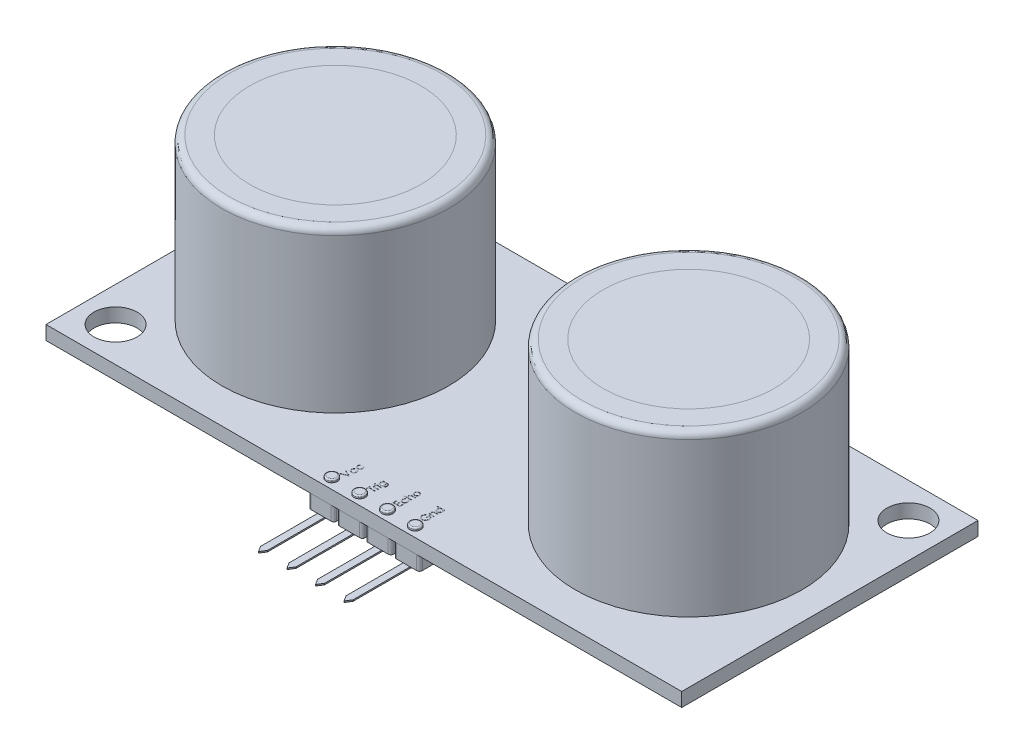
from build123d import *

# Parameters (mm, degrees)
SKETCH1_W              = 45.7
SKETCH1_H              = 21.3
SKETCH1_R              = 1.55
BOSS_EXTRUDE1_DEPTH    = 1
SKETCH2_R              = 8.15
SKETCH2_R_2            = 6.15
BOSS_EXTRUDE2_DEPTH    = 11.54
BOSS_EXTRUDE2_2_DEPTH  = 11.54
FILLET1_R              = 0.5
FILLET2_R              = 0.5
SKETCH3_R              = 6
BOSS_EXTRUDE3_DEPTH    = 7
BOSS_EXTRUDE3_2_DEPTH  = 7
LPATTERN2_COUNT        = 2
LPATTERN2_PITCH        = 25.4
SKETCH6_R              = 6.15
BOSS_EXTRUDE4_DEPTH    = 0.2
BOSS_EXTRUDE4_2_DEPTH  = 0.2
BOSS_EXTRUDE10_DEPTH   = 1
BOSS_EXTRUDE10_2_DEPTH = 1
BOSS_EXTRUDE10_3_DEPTH = 1
BOSS_EXTRUDE10_4_DEPTH = 1
SKETCH13_R             = 0.4
BOSS_EXTRUDE8_DEPTH    = 0.2
BOSS_EXTRUDE8_2_DEPTH  = 0.2
BOSS_EXTRUDE8_3_DEPTH  = 0.2
BOSS_EXTRUDE8_4_DEPTH  = 0.2
FILLET3_R              = 0.1
FILLET4_R              = 0.1
FILLET5_R              = 0.1
FILLET6_R              = 0.1
SKETCH15_W             = 0.365384615
SKETCH15_H             = 0.044871795
CUT_EXTRUDE5_DEPTH     = 0.01
BOSS_EXTRUDE11_DEPTH   = 0.1
BOSS_EXTRUDE11_2_DEPTH = 0.1
BOSS_EXTRUDE11_3_DEPTH = 0.1
BOSS_EXTRUDE11_4_DEPTH = 0.1
BOSS_EXTRUDE13_DEPTH   = 0.5
BOSS_EXTRUDE14_DEPTH   = 1.5
FILLET7_R              = 0.1


with BuildPart() as part:
    # Sketch1 → Boss-Extrude1 (new body)
    with BuildSketch(Plane(origin=(0, 0, 0), x_dir=(1, 0, 0), z_dir=(0, 1, 0))):
        Rectangle(SKETCH1_W, SKETCH1_H)
        with Locations((20.35, 8.15)):
            Circle(SKETCH1_R, mode=Mode.SUBTRACT)
        with Locations((-20.35, -8.15)):
            Circle(SKETCH1_R, mode=Mode.SUBTRACT)
    extrude(amount=BOSS_EXTRUDE1_DEPTH)

    # Sketch15 → Cut-Extrude5 (cut)
    # profile 1 of 15: a face of its own
    with BuildSketch(Plane(origin=(0, 1, 0), x_dir=(1, 0, 0), z_dir=(0, 1, 0))):
        with BuildLine():
            Line((-2.771008341, -8.073076923), (-2.747671001, -8.110637019))
            add(Edge.make_bspline(
                [(-2.747671001, -8.110637019), (-2.752789343, -8.114755571), (-2.76286393, -8.122862242), (-2.775865349, -8.136939276), (-2.787032069, -8.151940907), (-2.796132605, -8.168123485), (-2.803164241, -8.185464313), (-2.808139985, -8.203895006), (-2.811240591, -8.223412936), (-2.811592996, -8.236793678), (-2.811773565, -8.24364984)],
                knots=[0, 0, 0, 0, 1.026593902, 2.0206758, 2.988051866, 3.946915611, 4.916868779, 5.907761954, 6.927957743, 8, 8, 8, 8], degree=3))
            add(Edge.make_bspline(
                [(-2.811773565, -8.24364984), (-2.811622588, -8.249129691), (-2.811325242, -8.259922108), (-2.8094666, -8.275765844), (-2.80608917, -8.290857609), (-2.801639033, -8.305291996), (-2.795674706, -8.318966342), (-2.78841617, -8.331916473), (-2.779980449, -8.344257257), (-2.770207514, -8.355631077), (-2.759579133, -8.366035221), (-2.748185748, -8.375049352), (-2.736368621, -8.382897485), (-2.723832658, -8.389055479), (-2.71086465, -8.394094789), (-2.697219814, -8.397410035), (-2.683072955, -8.399619277), (-2.673427478, -8.399872038), (-2.668544398, -8.4)],
                knots=[0, 0, 0, 0, 1.112346261, 2.190735716, 3.231507886, 4.247384806, 5.251966152, 6.253067467, 7.256802811, 8.280671706, 9.291813951, 10.270744147, 11.225547591, 12.165006084, 13.100104208, 14.043489273, 15.009504848, 16, 16, 16, 16], degree=3))
            add(Edge.make_bspline(
                [(-2.668544398, -8.4), (-2.662149711, -8.399741969), (-2.649413775, -8.399228063), (-2.630645809, -8.395319409), (-2.612533755, -8.388779202), (-2.595175531, -8.379943686), (-2.579092049, -8.368728456), (-2.564665471, -8.355562063), (-2.552177566, -8.340430467), (-2.541824321, -8.323468787), (-2.533501276, -8.305074802), (-2.527571655, -8.28544765), (-2.523992745, -8.26474768), (-2.523541896, -8.250575287), (-2.523312027, -8.243349359)],
                knots=[0, 0, 0, 0, 0.96628757, 1.924499989, 2.884001032, 3.87047137, 4.860396324, 5.839257425, 6.814467993, 7.816059692, 8.834901047, 9.858382822, 10.908076205, 12, 12, 12, 12], degree=3))
            add(Edge.make_bspline(
                [(-2.523312027, -8.243349359), (-2.523497669, -8.23672719), (-2.523862506, -8.22371287), (-2.526938072, -8.204688972), (-2.531972877, -8.186577556), (-2.53899397, -8.169379266), (-2.548069329, -8.153125528), (-2.559263496, -8.13792136), (-2.572254439, -8.123464226), (-2.582299864, -8.114964658), (-2.587414591, -8.110637019)],
                knots=[0, 0, 0, 0, 1.039848629, 2.043578496, 3.018386758, 3.987534228, 4.954977003, 5.934852016, 6.948509513, 8, 8, 8, 8], degree=3))
            Line((-2.587414591, -8.110637019), (-2.562775168, -8.073076923))
            add(Edge.make_bspline(
                [(-2.562775168, -8.073076923), (-2.559505064, -8.075303738), (-2.55297571, -8.079749976), (-2.543769408, -8.087182494), (-2.535152024, -8.095199613), (-2.527135111, -8.103770055), (-2.519526823, -8.112781914), (-2.512690884, -8.122543043), (-2.506243052, -8.132738702), (-2.500441213, -8.143488582), (-2.495226024, -8.154681539), (-2.490741571, -8.166301823), (-2.486888699, -8.178298939), (-2.483826221, -8.190686993), (-2.481381815, -8.203490407), (-2.479759858, -8.216676069), (-2.478549104, -8.230239438), (-2.478476837, -8.239406888), (-2.478440232, -8.244050481)],
                knots=[0, 0, 0, 0, 0.954134338, 1.905101784, 2.851144739, 3.791306361, 4.734911809, 5.6936923, 6.663572882, 7.643865596, 8.638447847, 9.640600242, 10.646758161, 11.676244097, 12.717260333, 13.78922464, 14.880174919, 16, 16, 16, 16], degree=3))
            add(Edge.make_bspline(
                [(-2.478440232, -8.244050481), (-2.478567769, -8.251137657), (-2.478817743, -8.265028574), (-2.481558826, -8.285361669), (-2.485706466, -8.304787443), (-2.491608966, -8.323340034), (-2.499403895, -8.340906018), (-2.508707421, -8.357631633), (-2.519826998, -8.373344282), (-2.532498463, -8.387940957), (-2.546251285, -8.401289611), (-2.561005999, -8.41290504), (-2.576436566, -8.422748753), (-2.592640251, -8.430857682), (-2.60955061, -8.437198108), (-2.627270949, -8.441563266), (-2.645650922, -8.444379814), (-2.658184043, -8.444706284), (-2.664537988, -8.444871795)],
                knots=[0, 0, 0, 0, 1.113096611, 2.181677437, 3.217994567, 4.231807234, 5.234933164, 6.233258928, 7.234764453, 8.254006763, 9.267004511, 10.242118657, 11.199842941, 12.138404996, 13.084707599, 14.031460992, 15.002005182, 16, 16, 16, 16], degree=3))
            add(Edge.make_bspline(
                [(-2.664537988, -8.444871795), (-2.668849193, -8.444808793), (-2.677424891, -8.444683471), (-2.690152758, -8.443246052), (-2.702711122, -8.441389128), (-2.714940796, -8.438242594), (-2.727027266, -8.434608218), (-2.738824852, -8.429968856), (-2.750388376, -8.424526657), (-2.761688052, -8.418347807), (-2.772537986, -8.411392272), (-2.78278851, -8.403694953), (-2.792562762, -8.395545762), (-2.801523299, -8.386563461), (-2.810028469, -8.377129224), (-2.817851059, -8.366976142), (-2.825014057, -8.356162449), (-2.831649917, -8.344850546), (-2.837558407, -8.333047016), (-2.84264887, -8.320823206), (-2.846999238, -8.308252773), (-2.850443369, -8.295315609), (-2.853331572, -8.282097585), (-2.855148408, -8.268494536), (-2.856432161, -8.254558505), (-2.856573703, -8.24512193), (-2.85664536, -8.240344551)],
                knots=[0, 0, 0, 0, 0.990994727, 1.971252077, 2.943264845, 3.907940874, 4.872158414, 5.844625996, 6.82015047, 7.809835459, 8.804511986, 9.781214284, 10.756496977, 11.728388426, 12.696359165, 13.676225489, 14.672885716, 15.677705647, 16.690706858, 17.706033469, 18.721040654, 19.747369689, 20.783475414, 21.830280724, 22.901553713, 24, 24, 24, 24], degree=3))
            add(Edge.make_bspline(
                [(-2.85664536, -8.240344551), (-2.856513675, -8.234361671), (-2.856250963, -8.222425816), (-2.854039524, -8.204720112), (-2.850706512, -8.187274669), (-2.84576471, -8.170398053), (-2.839794347, -8.154285867), (-2.833049525, -8.139243645), (-2.825383038, -8.125498557), (-2.816841822, -8.112929361), (-2.807112014, -8.101539541), (-2.796292651, -8.091037172), (-2.784305854, -8.081353058), (-2.775477426, -8.075858402), (-2.771008341, -8.073076923)],
                knots=[0, 0, 0, 0, 1.095139042, 2.184804066, 3.262657822, 4.34424993, 5.400369085, 6.407210964, 7.359649996, 8.278719237, 9.185177137, 10.097389079, 11.036869154, 12, 12, 12, 12], degree=3))
        make_face()
    # profile 2 of 15: a face of its own
    with BuildSketch(Plane(origin=(0, 1, 0), x_dir=(1, 0, 0), z_dir=(0, 1, 0))):
        with BuildLine():
            Line((-2.771008341, -8.521794872), (-2.747671001, -8.559354968))
            add(Edge.make_bspline(
                [(-2.747671001, -8.559354968), (-2.752789343, -8.56347352), (-2.76286393, -8.571580191), (-2.775865349, -8.585657225), (-2.787032069, -8.600658855), (-2.796132605, -8.616841434), (-2.803164241, -8.634182262), (-2.808139985, -8.652612955), (-2.811240591, -8.672130884), (-2.811592996, -8.685511627), (-2.811773565, -8.692367788)],
                knots=[0, 0, 0, 0, 1.026593902, 2.0206758, 2.988051866, 3.946915611, 4.916868779, 5.907761954, 6.927957743, 8, 8, 8, 8], degree=3))
            add(Edge.make_bspline(
                [(-2.811773565, -8.692367788), (-2.811622588, -8.697847639), (-2.811325242, -8.708640057), (-2.8094666, -8.724483793), (-2.80608917, -8.739575558), (-2.801639033, -8.754009945), (-2.795674706, -8.76768429), (-2.78841617, -8.780634422), (-2.779980449, -8.792975206), (-2.770207514, -8.804349026), (-2.759579133, -8.81475317), (-2.748185748, -8.823767301), (-2.736368621, -8.831615434), (-2.723832658, -8.837773428), (-2.71086465, -8.842812738), (-2.697219814, -8.846127983), (-2.683072955, -8.848337226), (-2.673427478, -8.848589987), (-2.668544398, -8.848717949)],
                knots=[0, 0, 0, 0, 1.112346261, 2.190735716, 3.231507886, 4.247384806, 5.251966152, 6.253067467, 7.256802811, 8.280671706, 9.291813951, 10.270744147, 11.225547591, 12.165006084, 13.100104208, 14.043489273, 15.009504848, 16, 16, 16, 16], degree=3))
            add(Edge.make_bspline(
                [(-2.668544398, -8.848717949), (-2.662149711, -8.848459918), (-2.649413775, -8.847946012), (-2.630645809, -8.844037358), (-2.612533755, -8.837497151), (-2.595175531, -8.828661635), (-2.579092049, -8.817446404), (-2.564665471, -8.804280012), (-2.552177566, -8.789148415), (-2.541824321, -8.772186736), (-2.533501276, -8.75379275), (-2.527571655, -8.734165599), (-2.523992745, -8.713465628), (-2.523541896, -8.699293236), (-2.523312027, -8.692067308)],
                knots=[0, 0, 0, 0, 0.96628757, 1.924499989, 2.884001032, 3.87047137, 4.860396324, 5.839257425, 6.814467993, 7.816059692, 8.834901047, 9.858382822, 10.908076205, 12, 12, 12, 12], degree=3))
            add(Edge.make_bspline(
                [(-2.523312027, -8.692067308), (-2.523497669, -8.685445138), (-2.523862506, -8.672430819), (-2.526938072, -8.653406921), (-2.531972877, -8.635295505), (-2.53899397, -8.618097215), (-2.548069329, -8.601843477), (-2.559263496, -8.586639309), (-2.572254439, -8.572182175), (-2.582299864, -8.563682607), (-2.587414591, -8.559354968)],
                knots=[0, 0, 0, 0, 1.039848629, 2.043578496, 3.018386758, 3.987534228, 4.954977003, 5.934852016, 6.948509513, 8, 8, 8, 8], degree=3))
            Line((-2.587414591, -8.559354968), (-2.562775168, -8.521794872))
            add(Edge.make_bspline(
                [(-2.562775168, -8.521794872), (-2.559505064, -8.524021686), (-2.55297571, -8.528467925), (-2.543769408, -8.535900442), (-2.535152024, -8.543917561), (-2.527135111, -8.552488004), (-2.519526823, -8.561499862), (-2.512690884, -8.571260992), (-2.506243052, -8.581456651), (-2.500441213, -8.592206531), (-2.495226024, -8.603399487), (-2.490741571, -8.615019772), (-2.486888699, -8.627016888), (-2.483826221, -8.639404942), (-2.481381815, -8.652208356), (-2.479759858, -8.665394018), (-2.478549104, -8.678957386), (-2.478476837, -8.688124837), (-2.478440232, -8.692768429)],
                knots=[0, 0, 0, 0, 0.954134338, 1.905101784, 2.851144739, 3.791306361, 4.734911809, 5.6936923, 6.663572882, 7.643865596, 8.638447847, 9.640600242, 10.646758161, 11.676244097, 12.717260333, 13.78922464, 14.880174919, 16, 16, 16, 16], degree=3))
            add(Edge.make_bspline(
                [(-2.478440232, -8.692768429), (-2.478567769, -8.699855606), (-2.478817743, -8.713746523), (-2.481558826, -8.734079618), (-2.485706466, -8.753505392), (-2.491608966, -8.772057982), (-2.499403895, -8.789623967), (-2.508707421, -8.806349582), (-2.519826998, -8.82206223), (-2.532498463, -8.836658905), (-2.546251285, -8.85000756), (-2.561005999, -8.861622989), (-2.576436566, -8.871466702), (-2.592640251, -8.879575631), (-2.60955061, -8.885916057), (-2.627270949, -8.890281215), (-2.645650922, -8.893097763), (-2.658184043, -8.893424232), (-2.664537988, -8.893589744)],
                knots=[0, 0, 0, 0, 1.113096611, 2.181677437, 3.217994567, 4.231807234, 5.234933164, 6.233258928, 7.234764453, 8.254006763, 9.267004511, 10.242118657, 11.199842941, 12.138404996, 13.084707599, 14.031460992, 15.002005182, 16, 16, 16, 16], degree=3))
            add(Edge.make_bspline(
                [(-2.664537988, -8.893589744), (-2.668849193, -8.893526741), (-2.677424891, -8.893401419), (-2.690152758, -8.891964001), (-2.702711122, -8.890107076), (-2.714940796, -8.886960542), (-2.727027266, -8.883326167), (-2.738824852, -8.878686805), (-2.750388376, -8.873244606), (-2.761688052, -8.867065756), (-2.772537986, -8.860110221), (-2.78278851, -8.852412902), (-2.792562762, -8.844263711), (-2.801523299, -8.835281409), (-2.810028469, -8.825847173), (-2.817851059, -8.815694091), (-2.825014057, -8.804880398), (-2.831649917, -8.793568494), (-2.837558407, -8.781764964), (-2.84264887, -8.769541154), (-2.846999238, -8.756970721), (-2.850443369, -8.744033558), (-2.853331572, -8.730815533), (-2.855148408, -8.717212485), (-2.856432161, -8.703276453), (-2.856573703, -8.693839879), (-2.85664536, -8.6890625)],
                knots=[0, 0, 0, 0, 0.990994727, 1.971252077, 2.943264845, 3.907940874, 4.872158414, 5.844625996, 6.82015047, 7.809835459, 8.804511986, 9.781214284, 10.756496977, 11.728388426, 12.696359165, 13.676225489, 14.672885716, 15.677705647, 16.690706858, 17.706033469, 18.721040654, 19.747369689, 20.783475414, 21.830280724, 22.901553713, 24, 24, 24, 24], degree=3))
            add(Edge.make_bspline(
                [(-2.85664536, -8.6890625), (-2.856513675, -8.68307962), (-2.856250963, -8.671143765), (-2.854039524, -8.65343806), (-2.850706512, -8.635992617), (-2.84576471, -8.619116001), (-2.839794347, -8.603003815), (-2.833049525, -8.587961594), (-2.825383038, -8.574216505), (-2.816841822, -8.561647309), (-2.807112014, -8.550257489), (-2.796292651, -8.539755121), (-2.784305854, -8.530071007), (-2.775477426, -8.524576351), (-2.771008341, -8.521794872)],
                knots=[0, 0, 0, 0, 1.095139042, 2.184804066, 3.262657822, 4.34424993, 5.400369085, 6.407210964, 7.359649996, 8.278719237, 9.185177137, 10.097389079, 11.036869154, 12, 12, 12, 12], degree=3))
        make_face()
    # profile 3 of 15: a face of its own
    with BuildSketch(Plane(origin=(0, 1, 0), x_dir=(1, 0, 0), z_dir=(0, 1, 0))):
        Polygon((-2.984850488, -9.393589744), (-2.984850488, -9.345512821), (-2.590820039, -9.178846154), (-2.984850488, -9.012179487), (-2.984850488, -8.964102564), (-2.484850488, -9.175641026), (-2.484850488, -9.182051282), align=None)
    # profile 4 of 15: a face of its own
    with BuildSketch(Plane(origin=(0, 1, 0), x_dir=(1, 0, 0), z_dir=(0, 1, 0))):
        with BuildLine():
            Line((-0.997671001, -8.323076923), (-0.997671001, -8.278205128))
            Line((-0.997671001, -8.278205128), (-0.707707059, -8.278205128))
            add(Edge.make_bspline(
                [(-0.707707059, -8.278205128), (-0.701530259, -8.278244706), (-0.689607549, -8.2783211), (-0.672367795, -8.278871239), (-0.656444068, -8.280031335), (-0.641763746, -8.281346861), (-0.628394873, -8.283239249), (-0.616297558, -8.285550159), (-0.605460192, -8.288155256), (-0.598785214, -8.290443858), (-0.595627732, -8.291526442)],
                knots=[0, 0, 0, 0, 1.307562039, 2.523909702, 3.650326591, 4.686913197, 5.643429486, 6.506965704, 7.293745905, 8, 8, 8, 8], degree=3))
            add(Edge.make_bspline(
                [(-0.595627732, -8.291526442), (-0.591523467, -8.293124913), (-0.583437652, -8.29627406), (-0.571975468, -8.302171897), (-0.561183639, -8.308777152), (-0.551119247, -8.316319448), (-0.54184421, -8.324773833), (-0.533128421, -8.333892025), (-0.525299785, -8.343993911), (-0.518264274, -8.354902601), (-0.511803718, -8.366397845), (-0.50629187, -8.378566079), (-0.501694755, -8.391341933), (-0.497912126, -8.404666455), (-0.494860467, -8.418538869), (-0.492824357, -8.433005352), (-0.49145333, -8.448017017), (-0.491325565, -8.458223325), (-0.491260745, -8.463401442)],
                knots=[0, 0, 0, 0, 0.98202571, 1.934689484, 2.871054655, 3.802072519, 4.735470746, 5.668036537, 6.612630213, 7.581518814, 8.561763468, 9.551722253, 10.55777311, 11.588015789, 12.63986657, 13.723744117, 14.845153492, 16, 16, 16, 16], degree=3))
            add(Edge.make_bspline(
                [(-0.491260745, -8.463401442), (-0.491398444, -8.470954291), (-0.491667335, -8.485703082), (-0.494237549, -8.507250304), (-0.498383337, -8.527647451), (-0.504290118, -8.546745865), (-0.51159439, -8.564353393), (-0.519961827, -8.580371702), (-0.529561107, -8.594653137), (-0.540489557, -8.607527987), (-0.553484427, -8.619148203), (-0.56879853, -8.630080676), (-0.586665234, -8.640603667), (-0.599778478, -8.646770615), (-0.60664536, -8.65)],
                knots=[0, 0, 0, 0, 1.157856589, 2.260999188, 3.322382479, 4.345906448, 5.321474636, 6.242187631, 7.112686896, 7.955149481, 8.825136643, 9.778649332, 10.836767353, 12, 12, 12, 12], degree=3))
            Line((-0.60664536, -8.65), (-0.60664536, -8.605128205))
            add(Edge.make_bspline(
                [(-0.60664536, -8.605128205), (-0.600917786, -8.601517682), (-0.589721084, -8.594459554), (-0.575209435, -8.581304421), (-0.562921457, -8.566781581), (-0.552951172, -8.55058289), (-0.545275698, -8.53259537), (-0.539944399, -8.512702648), (-0.536718994, -8.490850286), (-0.536333356, -8.475632713), (-0.536132539, -8.467708333)],
                knots=[0, 0, 0, 0, 0.997887113, 1.950746426, 2.877762071, 3.798308985, 4.747694893, 5.754452072, 6.830656281, 8, 8, 8, 8], degree=3))
            add(Edge.make_bspline(
                [(-0.536132539, -8.467708333), (-0.536335992, -8.459884147), (-0.536728227, -8.4447999), (-0.53994568, -8.423114342), (-0.545277357, -8.403286508), (-0.552935516, -8.38553539), (-0.562134175, -8.369971421), (-0.57230764, -8.356477096), (-0.583915231, -8.345633881), (-0.594592505, -8.338312809), (-0.604111131, -8.333766176), (-0.61230383, -8.330868136), (-0.621538296, -8.328530902), (-0.631836565, -8.326524556), (-0.643202589, -8.324934754), (-0.65567513, -8.323891683), (-0.669169826, -8.323151364), (-0.678525914, -8.32310231), (-0.683368116, -8.323076923)],
                knots=[0, 0, 0, 0, 1.570880491, 3.028500349, 4.391799536, 5.683507043, 6.897971719, 8.016608159, 9.065046722, 10.074948333, 10.602832593, 11.179761774, 11.817338097, 12.514350094, 13.286299219, 14.121078732, 15.027572402, 16, 16, 16, 16], degree=3))
            Line((-0.683368116, -8.323076923), (-0.702298405, -8.323076923))
            add(Edge.make_bspline(
                [(-0.702298405, -8.323076923), (-0.696880347, -8.327632902), (-0.686139534, -8.336664722), (-0.672040067, -8.3522204), (-0.660043648, -8.369318353), (-0.650065029, -8.387716899), (-0.642159081, -8.407141835), (-0.636430531, -8.427249727), (-0.632877272, -8.447984125), (-0.632484744, -8.462018483), (-0.632286386, -8.469110577)],
                knots=[0, 0, 0, 0, 1.012670515, 2.007528466, 2.995541538, 3.996581493, 4.997861088, 5.991949332, 6.98525577, 8, 8, 8, 8], degree=3))
            add(Edge.make_bspline(
                [(-0.632286386, -8.469110577), (-0.632374509, -8.473285601), (-0.632549648, -8.481583134), (-0.63361503, -8.493945102), (-0.635689687, -8.506068824), (-0.638346295, -8.51803153), (-0.641907404, -8.529749643), (-0.646087008, -8.54136357), (-0.651220666, -8.552704648), (-0.657000461, -8.563830743), (-0.663494463, -8.574480094), (-0.670510718, -8.584619216), (-0.67803427, -8.594185751), (-0.686133585, -8.603091069), (-0.694798441, -8.611322851), (-0.703936073, -8.618991983), (-0.713674184, -8.625971602), (-0.723835177, -8.632404944), (-0.734486738, -8.637984594), (-0.745397894, -8.642882361), (-0.756545316, -8.647140847), (-0.767966325, -8.650535905), (-0.779653721, -8.653128921), (-0.791588356, -8.655058953), (-0.803806983, -8.656153658), (-0.812038604, -8.656324361), (-0.816180616, -8.656410256)],
                knots=[0, 0, 0, 0, 1.028710361, 2.044481286, 3.053267669, 4.056977562, 5.061496029, 6.068537106, 7.095799505, 8.125955792, 9.155750787, 10.166547241, 11.162135275, 12.151998358, 13.129411568, 14.10464185, 15.088574784, 16.079052837, 17.065149435, 18.048153627, 19.024354702, 20.002874835, 20.980703288, 21.971932454, 22.97951087, 24, 24, 24, 24], degree=3))
            add(Edge.make_bspline(
                [(-0.816180616, -8.656410256), (-0.820323916, -8.65633609), (-0.828594467, -8.656188044), (-0.840862951, -8.654909333), (-0.852967156, -8.653085305), (-0.864782319, -8.650198481), (-0.876442998, -8.646723835), (-0.887863063, -8.642420468), (-0.899045993, -8.637246359), (-0.910000069, -8.631387824), (-0.920578299, -8.624804382), (-0.930624963, -8.617585456), (-0.94006613, -8.609722331), (-0.948997048, -8.601323486), (-0.957331547, -8.592286369), (-0.965049399, -8.582615656), (-0.972279974, -8.572406673), (-0.978867308, -8.56162778), (-0.984693343, -8.550445296), (-0.990009429, -8.539143322), (-0.994228588, -8.527572146), (-0.997946174, -8.515947497), (-1.000579773, -8.504064652), (-1.002611522, -8.49206931), (-1.003849339, -8.479920405), (-1.004003852, -8.471784277), (-1.004081257, -8.467708333)],
                knots=[0, 0, 0, 0, 1.008818848, 2.013730394, 3.001654427, 3.987803273, 4.973046549, 5.963777569, 6.957074694, 7.972068341, 8.987420212, 9.989399531, 10.982630087, 11.977756091, 12.973280677, 13.973972381, 14.989194003, 16.018387222, 17.047741039, 18.059210846, 19.057554164, 20.045176975, 21.029480261, 22.018708529, 23.007435371, 24, 24, 24, 24], degree=3))
            add(Edge.make_bspline(
                [(-1.004081257, -8.467708333), (-1.003887447, -8.460986771), (-1.003504731, -8.44771375), (-1.00050171, -8.428180749), (-0.995713994, -8.409331858), (-0.988854618, -8.391060713), (-0.979490327, -8.373218477), (-0.96715562, -8.355863955), (-0.951739857, -8.338946935), (-0.939918019, -8.328507245), (-0.933768757, -8.323076923)],
                knots=[0, 0, 0, 0, 0.96728863, 1.910097829, 2.838038873, 3.762875196, 4.71315279, 5.730631239, 6.819562287, 8, 8, 8, 8], degree=3))
            Line((-0.933768757, -8.323076923), (-0.997671001, -8.323076923))
        make_face()
        with BuildLine():
            add(Edge.make_bspline(
                [(-0.959209462, -8.464102564), (-0.958985635, -8.470663676), (-0.958542503, -8.483653286), (-0.954785181, -8.502700557), (-0.948838122, -8.521046355), (-0.940560513, -8.538509789), (-0.930099085, -8.55468857), (-0.917652726, -8.569167271), (-0.903392187, -8.581790654), (-0.887501177, -8.592471897), (-0.87033042, -8.601004597), (-0.852239491, -8.606965045), (-0.83354441, -8.610904833), (-0.820807971, -8.611325885), (-0.814377732, -8.611538462)],
                knots=[0, 0, 0, 0, 1.026191648, 2.031641866, 3.026511193, 4.038688626, 5.047555432, 6.033268986, 7.01798463, 8.019529538, 9.022150945, 10.008736843, 10.994672018, 12, 12, 12, 12], degree=3))
            add(Edge.make_bspline(
                [(-0.814377732, -8.611538462), (-0.809530278, -8.611434365), (-0.799996755, -8.611229639), (-0.786003388, -8.609275066), (-0.772655107, -8.606077365), (-0.759964589, -8.601659433), (-0.747930218, -8.59601418), (-0.736552832, -8.589051405), (-0.725826064, -8.58080999), (-0.71584043, -8.571403184), (-0.70674619, -8.561034715), (-0.698754992, -8.549789226), (-0.692219188, -8.537681303), (-0.686570493, -8.52500891), (-0.682444913, -8.511464514), (-0.679296516, -8.497243217), (-0.677495265, -8.482244403), (-0.677272008, -8.472019868), (-0.67715818, -8.466806891)],
                knots=[0, 0, 0, 0, 1.039710933, 2.044807362, 3.024849673, 3.981007225, 4.923240656, 5.871799057, 6.837597342, 7.820855272, 8.810901995, 9.792827897, 10.773995565, 11.758948565, 12.765014796, 13.806304263, 14.881544521, 16, 16, 16, 16], degree=3))
            add(Edge.make_bspline(
                [(-0.67715818, -8.466806891), (-0.677267839, -8.461526354), (-0.677482275, -8.45120032), (-0.679325632, -8.436118758), (-0.6823002, -8.421828366), (-0.686523489, -8.408342249), (-0.691912311, -8.395609486), (-0.698731827, -8.383773112), (-0.706498175, -8.372579334), (-0.715557034, -8.362385561), (-0.725540605, -8.353167823), (-0.736404161, -8.345134857), (-0.747984235, -8.338289935), (-0.760279522, -8.332621697), (-0.773385572, -8.328294382), (-0.787269623, -8.325391681), (-0.801865157, -8.323362146), (-0.811866388, -8.323173443), (-0.816981898, -8.323076923)],
                knots=[0, 0, 0, 0, 1.121943988, 2.193949579, 3.223793937, 4.220241907, 5.192961521, 6.155822191, 7.11847367, 8.083710714, 9.04790392, 10.001595906, 10.949595423, 11.902125208, 12.873731292, 13.87582262, 14.913508608, 16, 16, 16, 16], degree=3))
            add(Edge.make_bspline(
                [(-0.816981898, -8.323076923), (-0.82364145, -8.323268633), (-0.836651874, -8.323643168), (-0.85561197, -8.327166515), (-0.873457556, -8.33288198), (-0.890142968, -8.34081413), (-0.905435801, -8.350799757), (-0.918948802, -8.362944844), (-0.931054645, -8.376711981), (-0.941008495, -8.392437847), (-0.949122007, -8.409269981), (-0.955011523, -8.426960133), (-0.958478604, -8.445337173), (-0.958964441, -8.457811434), (-0.959209462, -8.464102564)],
                knots=[0, 0, 0, 0, 1.070678282, 2.091729125, 3.090678259, 4.078281522, 5.055707048, 6.018451281, 6.993304669, 7.996175111, 9.002951586, 9.993356152, 10.987991402, 12, 12, 12, 12], degree=3))
        make_face(mode=Mode.SUBTRACT)
    # profile 5 of 15: a face of its own
    with BuildSketch(Plane(origin=(0, 1, 0), x_dir=(1, 0, 0), z_dir=(0, 1, 0))):
        with BuildLine():
            add(Edge.make_bspline(
                [(-1.151517155, -8.768790064), (-1.15138799, -8.76600559), (-1.151135061, -8.760553056), (-1.148969136, -8.752668304), (-1.145297752, -8.74548873), (-1.140372083, -8.739120483), (-1.134579306, -8.733655928), (-1.127827739, -8.729830112), (-1.120533648, -8.727371198), (-1.115445778, -8.727074262), (-1.112855296, -8.726923077)],
                knots=[0, 0, 0, 0, 1.055194115, 2.066272739, 3.074728998, 4.095836921, 5.109056067, 6.073838105, 7.019297344, 8, 8, 8, 8], degree=3))
            add(Edge.make_bspline(
                [(-1.112855296, -8.726923077), (-1.11033206, -8.727077671), (-1.10534392, -8.727383286), (-1.098176281, -8.729828213), (-1.091518527, -8.733688532), (-1.085736997, -8.739116979), (-1.080814051, -8.745489659), (-1.077141945, -8.752668057), (-1.074976211, -8.760553121), (-1.074723256, -8.766005612), (-1.074594078, -8.768790064)],
                knots=[0, 0, 0, 0, 0.96129708, 1.900370562, 2.859976407, 3.87933698, 4.906634145, 5.921202961, 6.938410037, 8, 8, 8, 8], degree=3))
            add(Edge.make_bspline(
                [(-1.074594078, -8.768790064), (-1.074718324, -8.771542675), (-1.074960152, -8.776900272), (-1.07718444, -8.784666964), (-1.080815308, -8.791785319), (-1.085704763, -8.798165987), (-1.091554034, -8.803484586), (-1.098172218, -8.807355775), (-1.105344955, -8.809795056), (-1.110332407, -8.810101431), (-1.112855296, -8.81025641)],
                knots=[0, 0, 0, 0, 1.054934014, 2.053291228, 3.073705704, 4.106921865, 5.123545215, 6.088680038, 7.033164197, 8, 8, 8, 8], degree=3))
            add(Edge.make_bspline(
                [(-1.112855296, -8.81025641), (-1.115445417, -8.810104826), (-1.120532579, -8.809807106), (-1.127831869, -8.807353947), (-1.134543512, -8.803516831), (-1.140404298, -8.798162465), (-1.145296503, -8.791786257), (-1.148926643, -8.784666722), (-1.15115112, -8.776900336), (-1.151392922, -8.771542697), (-1.151517155, -8.768790064)],
                knots=[0, 0, 0, 0, 0.98631895, 1.937192651, 2.907499808, 3.917963147, 4.944918757, 5.95915025, 6.951458133, 8, 8, 8, 8], degree=3))
        make_face()
    # profile 6 of 15: a face of its own
    with BuildSketch(Plane(origin=(0, 1, 0), x_dir=(1, 0, 0), z_dir=(0, 1, 0))):
        with Locations((-0.814978694, -8.768589744)):
            Rectangle(SKETCH15_W, SKETCH15_H)
    # profile 7 of 15: a face of its own
    with BuildSketch(Plane(origin=(0, 1, 0), x_dir=(1, 0, 0), z_dir=(0, 1, 0))):
        with BuildLine():
            Line((-0.997671001, -9.008974359), (-0.997671001, -8.964102564))
            Line((-0.997671001, -8.964102564), (-0.943884943, -8.964102564))
            add(Edge.make_bspline(
                [(-0.943884943, -8.964102564), (-0.948895161, -8.960792004), (-0.958477163, -8.954460583), (-0.971132965, -8.943887752), (-0.98173113, -8.933173527), (-0.990069549, -8.922036573), (-0.996371357, -8.910586078), (-1.00079944, -8.898918598), (-1.003545429, -8.887005603), (-1.003902409, -8.878980537), (-1.004081257, -8.874959936)],
                knots=[0, 0, 0, 0, 1.280091057, 2.448164201, 3.510831157, 4.48793739, 5.405868014, 6.289422536, 7.142991551, 8, 8, 8, 8], degree=3))
            add(Edge.make_bspline(
                [(-1.004081257, -8.874959936), (-1.003911182, -8.871841889), (-1.003561241, -8.865426306), (-1.001102552, -8.855714507), (-0.99717712, -8.8457083), (-0.99348566, -8.839259387), (-0.991561225, -8.835897436)],
                knots=[0, 0, 0, 0, 0.901110191, 1.854092781, 2.881294221, 4, 4, 4, 4], degree=3))
            Line((-0.991561225, -8.835897436), (-0.952699046, -8.860536859))
            add(Edge.make_bspline(
                [(-0.952699046, -8.860536859), (-0.953661941, -8.862695291), (-0.9554897, -8.866792407), (-0.957652845, -8.872785916), (-0.958926547, -8.878311822), (-0.959119506, -8.88183233), (-0.959209462, -8.883473558)],
                knots=[0, 0, 0, 0, 1.180555205, 2.24091978, 3.179933427, 4, 4, 4, 4], degree=3))
            add(Edge.make_bspline(
                [(-0.959209462, -8.883473558), (-0.958971337, -8.887075458), (-0.958485629, -8.89442229), (-0.954612677, -8.905172481), (-0.948535131, -8.915697534), (-0.941614604, -8.923975853), (-0.934966832, -8.930408263), (-0.929148566, -8.935034288), (-0.922564165, -8.939186215), (-0.915468132, -8.943213694), (-0.907682376, -8.946955526), (-0.899194196, -8.950299403), (-0.890073683, -8.953426571), (-0.883731978, -8.955187649), (-0.880483501, -8.956089744)],
                knots=[0, 0, 0, 0, 1.125322384, 2.295331465, 3.535939348, 4.916963136, 5.656144286, 6.429838446, 7.238666481, 8.090384391, 8.983239461, 9.940052224, 10.944811494, 12, 12, 12, 12], degree=3))
            add(Edge.make_bspline(
                [(-0.880483501, -8.956089744), (-0.877586922, -8.956766968), (-0.871139047, -8.958274491), (-0.860370848, -8.959701119), (-0.847656758, -8.961167459), (-0.832982009, -8.962168822), (-0.81629019, -8.963114743), (-0.79765331, -8.963637309), (-0.777020145, -8.964085938), (-0.762628594, -8.964096845), (-0.75508286, -8.964102564)],
                knots=[0, 0, 0, 0, 0.566841273, 1.261806378, 2.068780918, 3.007109044, 4.065315289, 5.256255371, 6.561408263, 8, 8, 8, 8], degree=3))
            Line((-0.75508286, -8.964102564), (-0.632286386, -8.964102564))
            Line((-0.632286386, -8.964102564), (-0.632286386, -9.008974359))
            Line((-0.632286386, -9.008974359), (-0.997671001, -9.008974359))
        make_face()
    # profile 8 of 15: a face of its own
    with BuildSketch(Plane(origin=(0, 1, 0), x_dir=(1, 0, 0), z_dir=(0, 1, 0))):
        Polygon((-1.081004334, -9.335897436), (-1.132286386, -9.335897436), (-1.132286386, -9.073076923), (-1.081004334, -9.073076923), (-1.081004334, -9.182051282), (-0.632286386, -9.182051282), (-0.632286386, -9.226923077), (-1.081004334, -9.226923077), align=None)
    # profile 9 of 15: a face of its own
    with BuildSketch(Plane(origin=(0, 1, 0), x_dir=(1, 0, 0), z_dir=(0, 1, 0))):
        with BuildLine():
            add(Edge.make_bspline(
                [(0.848482845, -7.877363782), (0.84862883, -7.870507886), (0.84891507, -7.857065149), (0.85197435, -7.837378308), (0.856652545, -7.818586146), (0.863119911, -7.80061669), (0.871788761, -7.783700076), (0.882132946, -7.767589899), (0.894387602, -7.752330326), (0.903867326, -7.743184179), (0.908679159, -7.738541667)],
                knots=[0, 0, 0, 0, 1.054011418, 2.066658804, 3.057071809, 4.030435133, 4.997543892, 5.974964718, 6.972108034, 8, 8, 8, 8], degree=3))
            add(Edge.make_bspline(
                [(0.908679159, -7.738541667), (0.913281157, -7.734544245), (0.922396092, -7.726626762), (0.937175465, -7.716474516), (0.952481194, -7.707728579), (0.968516526, -7.700719585), (0.985141479, -7.695193153), (1.002413195, -7.691269482), (1.02029353, -7.688935634), (1.032436936, -7.688620924), (1.038587012, -7.688461538)],
                knots=[0, 0, 0, 0, 1.025258237, 2.030674902, 3.01204498, 3.988269485, 4.97094183, 5.956517959, 6.965070386, 8, 8, 8, 8], degree=3))
            add(Edge.make_bspline(
                [(1.038587012, -7.688461538), (1.044772734, -7.68860173), (1.056996011, -7.688878754), (1.074998777, -7.69149927), (1.09245518, -7.69557514), (1.109292137, -7.701408259), (1.125561112, -7.708887989), (1.141191048, -7.71801523), (1.156212781, -7.728854033), (1.170498758, -7.741140318), (1.18366536, -7.754719157), (1.195140827, -7.769450036), (1.204972473, -7.785043469), (1.212891961, -7.801706805), (1.219136204, -7.819287875), (1.223521921, -7.837824599), (1.22617359, -7.85728818), (1.2265141, -7.870577783), (1.226687973, -7.877363782)],
                knots=[0, 0, 0, 0, 0.998656419, 1.973391657, 2.932242238, 3.890759089, 4.846373663, 5.82037756, 6.809684879, 7.83454468, 8.860553229, 9.859544525, 10.845671541, 11.83227036, 12.833544569, 13.85385346, 14.904124723, 16, 16, 16, 16], degree=3))
            add(Edge.make_bspline(
                [(1.226687973, -7.877363782), (1.226513517, -7.884183028), (1.226171835, -7.897538865), (1.223532223, -7.917071148), (1.219138225, -7.935641093), (1.212871441, -7.953245179), (1.20497222, -7.969980157), (1.19517055, -7.985663942), (1.183661957, -8.000406787), (1.17049968, -8.0139885), (1.156212543, -8.026274015), (1.141191109, -8.037113016), (1.125561096, -8.046240205), (1.109292141, -8.053719949), (1.092455179, -8.059553065), (1.074998777, -8.063628935), (1.056996011, -8.066249452), (1.044772734, -8.066526476), (1.038587012, -8.066666667)],
                knots=[0, 0, 0, 0, 1.099876186, 2.154163076, 3.173186993, 4.173200201, 5.163417411, 6.152872554, 7.150605724, 8.17532212, 9.198891216, 10.186952605, 11.159729845, 12.11414092, 13.071450619, 14.029093627, 15.002601286, 16, 16, 16, 16], degree=3))
            add(Edge.make_bspline(
                [(1.038587012, -8.066666667), (1.032470226, -8.066506575), (1.020360041, -8.066189621), (1.002515298, -8.063852588), (0.985296444, -8.05997161), (0.968762277, -8.054368566), (0.952765485, -8.047372582), (0.937403637, -8.038714669), (0.922688843, -8.028464218), (0.913585996, -8.020577494), (0.90897964, -8.016586538)],
                knots=[0, 0, 0, 0, 1.031377469, 2.041950136, 3.029500481, 4.003457997, 4.981637986, 5.969878303, 6.97268806, 8, 8, 8, 8], degree=3))
            add(Edge.make_bspline(
                [(0.90897964, -8.016586538), (0.904126077, -8.011951025), (0.894580692, -8.002834473), (0.88236176, -7.987498941), (0.871802321, -7.971428395), (0.863305719, -7.954324834), (0.856614502, -7.93637014), (0.851962286, -7.917481677), (0.848926092, -7.897728032), (0.848632067, -7.884219515), (0.848482845, -7.877363782)],
                knots=[0, 0, 0, 0, 1.027980169, 2.021703884, 2.998553061, 3.971491411, 4.943284454, 5.930300938, 6.949603206, 8, 8, 8, 8], degree=3))
        make_face()
        with BuildLine():
            add(Edge.make_bspline(
                [(0.89335464, -7.877564103), (0.893492439, -7.882412333), (0.893764479, -7.891983637), (0.895833609, -7.906072149), (0.899111823, -7.919635029), (0.903769546, -7.932698004), (0.909783671, -7.945217036), (0.917170593, -7.957204065), (0.925832394, -7.968694525), (0.935755827, -7.979462962), (0.946594962, -7.989347741), (0.958147334, -7.997981703), (0.970235984, -8.005364671), (0.982879104, -8.0114035), (0.996119803, -8.016034854), (1.009880104, -8.019316719), (1.02420156, -8.021389637), (1.033939148, -8.02165833), (1.038887493, -8.021794872)],
                knots=[0, 0, 0, 0, 1.02155314, 2.01673505, 2.994700672, 3.958461264, 4.934171024, 5.916582427, 6.921469794, 7.962398674, 8.998583302, 10.009097305, 10.997513862, 11.97957236, 12.956600784, 13.948243505, 14.957359924, 16, 16, 16, 16], degree=3))
            add(Edge.make_bspline(
                [(1.038887493, -8.021794872), (1.045280639, -8.021565326), (1.05796984, -8.021109719), (1.076657143, -8.017404685), (1.094597408, -8.011206645), (1.111685463, -8.002837034), (1.127495789, -7.992350431), (1.141591715, -7.979995136), (1.153761117, -7.96590375), (1.16385838, -7.95024425), (1.171881202, -7.933336491), (1.17756677, -7.915442731), (1.181262726, -7.896779774), (1.18163008, -7.884025384), (1.181816179, -7.877564103)],
                knots=[0, 0, 0, 0, 1.016792936, 2.018143844, 3.017858371, 4.030088057, 5.03801393, 6.028138512, 7.003788237, 7.991172063, 8.984598303, 9.972568034, 10.972917682, 12, 12, 12, 12], degree=3))
            add(Edge.make_bspline(
                [(1.181816179, -7.877564103), (1.181628996, -7.871103193), (1.181259502, -7.858349536), (1.177585385, -7.839712511), (1.17185629, -7.821867658), (1.163867403, -7.80497746), (1.153722773, -7.789325088), (1.141660433, -7.775132356), (1.127458454, -7.762882554), (1.111664522, -7.752406325), (1.0946239, -7.743899648), (1.076653832, -7.737730619), (1.057970683, -7.734016678), (1.045280922, -7.733562274), (1.038887493, -7.733333333)],
                knots=[0, 0, 0, 0, 1.02726834, 2.027799167, 3.010890988, 4.004497153, 4.992059811, 5.971914811, 6.958719428, 7.966827853, 8.981595046, 9.981490638, 10.983022906, 12, 12, 12, 12], degree=3))
            add(Edge.make_bspline(
                [(1.038887493, -7.733333333), (1.033939118, -7.733469828), (1.024201473, -7.733738429), (1.009880439, -7.735812021), (0.996118576, -7.739091396), (0.982883621, -7.743731904), (0.970203181, -7.749743909), (0.958182769, -7.757268806), (0.946554953, -7.765867504), (0.935790867, -7.775871541), (0.925828526, -7.786628739), (0.917167234, -7.798123854), (0.909816136, -7.810093109), (0.903718105, -7.822575771), (0.899154199, -7.835640421), (0.89581468, -7.849184297), (0.893773223, -7.863212699), (0.89349506, -7.872749705), (0.89335464, -7.877564103)],
                knots=[0, 0, 0, 0, 1.042975879, 2.052417305, 3.044379404, 4.0217225, 5.00409729, 5.996508862, 7.007348322, 8.048612455, 9.089876587, 10.095087598, 11.077815406, 12.047498138, 13.018202342, 13.98964644, 14.985148868, 16, 16, 16, 16], degree=3))
        make_face(mode=Mode.SUBTRACT)
    # profile 10 of 15: a face of its own
    with BuildSketch(Plane(origin=(0, 1, 0), x_dir=(1, 0, 0), z_dir=(0, 1, 0))):
        with BuildLine():
            Line((0.707457204, -8.476923077), (0.707457204, -8.432051282))
            Line((0.707457204, -8.432051282), (0.923903518, -8.432051282))
            add(Edge.make_bspline(
                [(0.923903518, -8.432051282), (0.917883624, -8.427234084), (0.906162582, -8.417854752), (0.890858824, -8.40207567), (0.877623602, -8.385830404), (0.866947863, -8.368694399), (0.858596505, -8.350817192), (0.852836222, -8.332173139), (0.849163234, -8.312837453), (0.848711624, -8.299689415), (0.848482845, -8.293028846)],
                knots=[0, 0, 0, 0, 1.125633083, 2.191665293, 3.205031882, 4.182434329, 5.134135993, 6.080017564, 7.027370072, 8, 8, 8, 8], degree=3))
            add(Edge.make_bspline(
                [(0.848482845, -8.293028846), (0.848717702, -8.286263917), (0.849177604, -8.273016681), (0.853241622, -8.253801295), (0.859635484, -8.235744949), (0.86871391, -8.219113542), (0.879925998, -8.204086395), (0.893005867, -8.190933586), (0.90795539, -8.179992816), (0.921847478, -8.172662166), (0.934206951, -8.167861926), (0.94481292, -8.164826899), (0.956630106, -8.162252438), (0.96965371, -8.160009708), (0.983945856, -8.158514883), (0.999442184, -8.157314232), (1.016141771, -8.15646045), (1.027701806, -8.156427364), (1.033679159, -8.156410256)],
                knots=[0, 0, 0, 0, 1.235771509, 2.41991536, 3.57472251, 4.727526861, 5.870395018, 6.992794988, 8.106410512, 9.245194824, 9.854018721, 10.52826073, 11.259975989, 12.064917182, 12.943387139, 13.886414983, 14.90712766, 16, 16, 16, 16], degree=3))
            Line((1.033679159, -8.156410256), (1.220277717, -8.156410256))
            Line((1.220277717, -8.156410256), (1.220277717, -8.201282051))
            Line((1.220277717, -8.201282051), (1.048402717, -8.201282051))
            add(Edge.make_bspline(
                [(1.048402717, -8.201282051), (1.043428044, -8.201309129), (1.03391234, -8.201360923), (1.020288693, -8.20153424), (1.007965156, -8.201912339), (0.996916148, -8.202545916), (0.987156642, -8.203183442), (0.978670697, -8.204087289), (0.971511549, -8.205131045), (0.96720232, -8.206069502), (0.965269704, -8.206490385)],
                knots=[0, 0, 0, 0, 1.430934443, 2.737134061, 3.918973087, 4.976914145, 5.92044225, 6.731742364, 7.431207999, 8, 8, 8, 8], degree=3))
            add(Edge.make_bspline(
                [(0.965269704, -8.206490385), (0.959594955, -8.208114851), (0.948714104, -8.211229627), (0.933960038, -8.218613836), (0.921267852, -8.22762254), (0.91099197, -8.238786956), (0.902928873, -8.251717566), (0.897348978, -8.266556484), (0.893884663, -8.283153689), (0.893536243, -8.294846832), (0.89335464, -8.300941506)],
                knots=[0, 0, 0, 0, 1.090133324, 2.090238182, 3.036763777, 3.954757083, 4.878717367, 5.838952881, 6.873623762, 8, 8, 8, 8], degree=3))
            add(Edge.make_bspline(
                [(0.89335464, -8.300941506), (0.893421637, -8.304551509), (0.893554222, -8.311695612), (0.894919046, -8.322283598), (0.897074601, -8.332586334), (0.900258549, -8.342576167), (0.904129627, -8.352273474), (0.908880214, -8.361717674), (0.914624186, -8.370779517), (0.921088969, -8.379575966), (0.928240727, -8.387764595), (0.935790568, -8.395382648), (0.943829776, -8.402173868), (0.952229812, -8.408326516), (0.961105777, -8.413637702), (0.97037211, -8.418273856), (0.980040987, -8.422207527), (0.98675171, -8.424162197), (0.990109448, -8.425140224)],
                knots=[0, 0, 0, 0, 1.024369801, 2.02720137, 3.025498567, 4.008789058, 4.999724648, 5.987391013, 7.005161842, 8.042127274, 9.083588116, 10.088924978, 11.084112559, 12.068088063, 13.041783903, 14.016724555, 15.007660144, 16, 16, 16, 16], degree=3))
            add(Edge.make_bspline(
                [(0.990109448, -8.425140224), (0.992541012, -8.425703), (0.99783969, -8.426929356), (1.00657888, -8.428260047), (1.016734076, -8.429451161), (1.028289876, -8.430458096), (1.041288624, -8.43107568), (1.055641619, -8.431741143), (1.071438764, -8.431988859), (1.082423837, -8.432029853), (1.088166339, -8.432051282)],
                knots=[0, 0, 0, 0, 0.607992626, 1.324890765, 2.152360218, 3.099583803, 4.150613268, 5.323148443, 6.60066238, 8, 8, 8, 8], degree=3))
            Line((1.088166339, -8.432051282), (1.220277717, -8.432051282))
            Line((1.220277717, -8.432051282), (1.220277717, -8.476923077))
            Line((1.220277717, -8.476923077), (0.707457204, -8.476923077))
        make_face()
    # profile 11 of 15: a face of its own
    with BuildSketch(Plane(origin=(0, 1, 0), x_dir=(1, 0, 0), z_dir=(0, 1, 0))):
        with BuildLine():
            Line((0.934119864, -8.566666667), (0.957457204, -8.604226763))
            add(Edge.make_bspline(
                [(0.957457204, -8.604226763), (0.952338862, -8.608345315), (0.942264275, -8.616451986), (0.929262856, -8.63052902), (0.918096136, -8.64553065), (0.9089956, -8.661713228), (0.901963964, -8.679054057), (0.89698822, -8.69748475), (0.893887614, -8.717002679), (0.893535209, -8.730383422), (0.89335464, -8.737239583)],
                knots=[0, 0, 0, 0, 1.026593902, 2.0206758, 2.988051866, 3.946915611, 4.916868779, 5.907761954, 6.927957743, 8, 8, 8, 8], degree=3))
            add(Edge.make_bspline(
                [(0.89335464, -8.737239583), (0.893505618, -8.742719434), (0.893802964, -8.753511852), (0.895661605, -8.769355588), (0.899039035, -8.784447353), (0.903489172, -8.79888174), (0.909453499, -8.812556085), (0.916712036, -8.825506216), (0.925147756, -8.837847001), (0.934920691, -8.849220821), (0.945549072, -8.859624965), (0.956942457, -8.868639095), (0.968759584, -8.876487229), (0.981295547, -8.882645222), (0.994263555, -8.887684533), (1.007908391, -8.890999778), (1.02205525, -8.89320902), (1.031700727, -8.893461782), (1.036583807, -8.893589744)],
                knots=[0, 0, 0, 0, 1.112346261, 2.190735716, 3.231507886, 4.247384806, 5.251966152, 6.253067467, 7.256802811, 8.280671706, 9.291813951, 10.270744147, 11.225547591, 12.165006084, 13.100104208, 14.043489273, 15.009504848, 16, 16, 16, 16], degree=3))
            add(Edge.make_bspline(
                [(1.036583807, -8.893589744), (1.042978494, -8.893331712), (1.05571443, -8.892817806), (1.074482396, -8.888909153), (1.09259445, -8.882368946), (1.109952674, -8.87353343), (1.126036156, -8.862318199), (1.140462734, -8.849151807), (1.152950639, -8.83402021), (1.163303884, -8.817058531), (1.171626929, -8.798664545), (1.17755655, -8.779037393), (1.18113546, -8.758337423), (1.181586309, -8.744165031), (1.181816179, -8.736939103)],
                knots=[0, 0, 0, 0, 0.96628757, 1.924499989, 2.884001032, 3.87047137, 4.860396324, 5.839257425, 6.814467993, 7.816059692, 8.834901047, 9.858382822, 10.908076205, 12, 12, 12, 12], degree=3))
            add(Edge.make_bspline(
                [(1.181816179, -8.736939103), (1.181630536, -8.730316933), (1.181265699, -8.717302614), (1.178190133, -8.698278716), (1.173155328, -8.6801673), (1.166134236, -8.66296901), (1.157058876, -8.646715272), (1.145864709, -8.631511104), (1.132873766, -8.61705397), (1.122828342, -8.608554402), (1.117713614, -8.604226763)],
                knots=[0, 0, 0, 0, 1.039848629, 2.043578496, 3.018386758, 3.987534228, 4.954977003, 5.934852016, 6.948509513, 8, 8, 8, 8], degree=3))
            Line((1.117713614, -8.604226763), (1.142353038, -8.566666667))
            add(Edge.make_bspline(
                [(1.142353038, -8.566666667), (1.145623141, -8.568893481), (1.152152495, -8.573339719), (1.161358798, -8.580772237), (1.169976181, -8.588789356), (1.177993094, -8.597359799), (1.185601382, -8.606371657), (1.192437321, -8.616132787), (1.198885153, -8.626328446), (1.204686992, -8.637078325), (1.209902181, -8.648271282), (1.214386634, -8.659891567), (1.218239506, -8.671888683), (1.221301984, -8.684276736), (1.22374639, -8.69708015), (1.225368347, -8.710265813), (1.226579101, -8.723829181), (1.226651368, -8.732996632), (1.226687973, -8.737640224)],
                knots=[0, 0, 0, 0, 0.954134338, 1.905101784, 2.851144739, 3.791306361, 4.734911809, 5.6936923, 6.663572882, 7.643865596, 8.638447847, 9.640600242, 10.646758161, 11.676244097, 12.717260333, 13.78922464, 14.880174919, 16, 16, 16, 16], degree=3))
            add(Edge.make_bspline(
                [(1.226687973, -8.737640224), (1.226560436, -8.744727401), (1.226310462, -8.758618318), (1.223569379, -8.778951413), (1.219421739, -8.798377187), (1.213519239, -8.816929777), (1.20572431, -8.834495762), (1.196420784, -8.851221377), (1.185301207, -8.866934025), (1.172629742, -8.8815307), (1.15887692, -8.894879355), (1.144122207, -8.906494784), (1.128691639, -8.916338497), (1.112487954, -8.924447426), (1.095577596, -8.930787852), (1.077857256, -8.93515301), (1.059477283, -8.937969558), (1.046944162, -8.938296027), (1.040590217, -8.938461538)],
                knots=[0, 0, 0, 0, 1.113096611, 2.181677437, 3.217994567, 4.231807234, 5.234933164, 6.233258928, 7.234764453, 8.254006763, 9.267004511, 10.242118657, 11.199842941, 12.138404996, 13.084707599, 14.031460992, 15.002005182, 16, 16, 16, 16], degree=3))
            add(Edge.make_bspline(
                [(1.040590217, -8.938461538), (1.036279012, -8.938398536), (1.027703314, -8.938273214), (1.014975447, -8.936835796), (1.002417084, -8.934978871), (0.990187409, -8.931832337), (0.978100939, -8.928197961), (0.966303354, -8.9235586), (0.954739829, -8.9181164), (0.943440153, -8.911937551), (0.932590219, -8.904982016), (0.922339695, -8.897284697), (0.912565443, -8.889135506), (0.903604906, -8.880153204), (0.895099736, -8.870718968), (0.887277147, -8.860565886), (0.880114148, -8.849752193), (0.873478289, -8.838440289), (0.867569798, -8.826636759), (0.862479335, -8.814412949), (0.858128967, -8.801842516), (0.854684836, -8.788905353), (0.851796633, -8.775687328), (0.849979797, -8.76208428), (0.848696044, -8.748148248), (0.848554502, -8.738711673), (0.848482845, -8.733934295)],
                knots=[0, 0, 0, 0, 0.990994727, 1.971252077, 2.943264845, 3.907940874, 4.872158414, 5.844625996, 6.82015047, 7.809835459, 8.804511986, 9.781214284, 10.756496977, 11.728388426, 12.696359165, 13.676225489, 14.672885716, 15.677705647, 16.690706858, 17.706033469, 18.721040654, 19.747369689, 20.783475414, 21.830280724, 22.901553713, 24, 24, 24, 24], degree=3))
            add(Edge.make_bspline(
                [(0.848482845, -8.733934295), (0.84861453, -8.727951415), (0.848877242, -8.71601556), (0.851088681, -8.698309855), (0.854421693, -8.680864412), (0.859363495, -8.663987796), (0.865333858, -8.64787561), (0.87207868, -8.632833389), (0.879745167, -8.6190883), (0.888286383, -8.606519104), (0.898016191, -8.595129284), (0.908835554, -8.584626915), (0.920822351, -8.574942802), (0.929650779, -8.569448146), (0.934119864, -8.566666667)],
                knots=[0, 0, 0, 0, 1.095139042, 2.184804066, 3.262657822, 4.34424993, 5.400369085, 6.407210964, 7.359649996, 8.278719237, 9.185177137, 10.097389079, 11.036869154, 12, 12, 12, 12], degree=3))
        make_face()
    # profile 12 of 15: a face of its own
    with BuildSketch(Plane(origin=(0, 1, 0), x_dir=(1, 0, 0), z_dir=(0, 1, 0))):
        Polygon((0.720277717, -9.284615385), (0.720277717, -9.002564103), (0.771559768, -9.002564103), (0.771559768, -9.23974359), (0.925405922, -9.23974359), (0.925405922, -9.002564103), (0.976687973, -9.002564103), (0.976687973, -9.23974359), (1.168995666, -9.23974359), (1.168995666, -9.002564103), (1.220277717, -9.002564103), (1.220277717, -9.284615385), align=None)
    # profile 13 of 15: a face of its own
    with BuildSketch(Plane(origin=(0, 1, 0), x_dir=(1, 0, 0), z_dir=(0, 1, 0))):
        with BuildLine():
            Line((2.560021307, -7.893589744), (3.07284182, -7.893589744))
            Line((3.07284182, -7.893589744), (3.07284182, -7.938461538))
            Line((3.07284182, -7.938461538), (3.009640698, -7.938461538))
            add(Edge.make_bspline(
                [(3.009640698, -7.938461538), (3.015351215, -7.943529265), (3.026511933, -7.953433704), (3.041226331, -7.969820106), (3.053140955, -7.987405616), (3.062903546, -8.005748962), (3.070207243, -8.025029822), (3.075407819, -8.045147419), (3.0787491, -8.066120976), (3.079082913, -8.080442672), (3.079252076, -8.087700321)],
                knots=[0, 0, 0, 0, 1.074325654, 2.099677833, 3.090439787, 4.057542011, 5.018572219, 5.985274637, 6.979019747, 8, 8, 8, 8], degree=3))
            add(Edge.make_bspline(
                [(3.079252076, -8.087700321), (3.07907688, -8.094152885), (3.078731386, -8.106877629), (3.076051057, -8.125596068), (3.071746682, -8.143609247), (3.065760841, -8.160934186), (3.057820723, -8.177458778), (3.048314831, -8.193324506), (3.036994712, -8.208449177), (3.024053565, -8.222602254), (3.009997138, -8.235635396), (2.995004917, -8.247072721), (2.979141731, -8.256608875), (2.962608424, -8.264583173), (2.945277721, -8.270725508), (2.927209554, -8.275007455), (2.908425286, -8.277684662), (2.895633926, -8.278030013), (2.889147909, -8.278205128)],
                knots=[0, 0, 0, 0, 1.033919861, 2.038935746, 3.024066025, 3.998881131, 4.97069526, 5.957263378, 6.95902576, 7.993208707, 9.027059324, 10.027763471, 11.009749337, 11.988697705, 12.965288445, 13.950418724, 14.960734635, 16, 16, 16, 16], degree=3))
            add(Edge.make_bspline(
                [(2.889147909, -8.278205128), (2.882795952, -8.278026132), (2.870238474, -8.277672267), (2.851770089, -8.275036093), (2.833981766, -8.270603092), (2.816930774, -8.26438197), (2.800596481, -8.256404548), (2.784967334, -8.246700536), (2.770000278, -8.235269232), (2.756047245, -8.222090317), (2.743158586, -8.207813921), (2.731957294, -8.192541245), (2.722283458, -8.176652205), (2.714618676, -8.159900347), (2.708417375, -8.142533617), (2.704126951, -8.124397411), (2.701598763, -8.105567185), (2.701232653, -8.092782829), (2.701046948, -8.086298077)],
                knots=[0, 0, 0, 0, 1.020392517, 2.01726096, 2.990465484, 3.961182959, 4.928053699, 5.906110375, 6.912531644, 7.948652711, 8.985773172, 9.998621852, 10.987621588, 11.969261332, 12.953316658, 13.946091881, 14.958173133, 16, 16, 16, 16], degree=3))
            add(Edge.make_bspline(
                [(2.701046948, -8.086298077), (2.701267965, -8.078837725), (2.701701796, -8.064193884), (2.705412995, -8.042800787), (2.711426002, -8.022512162), (2.719880272, -8.003284655), (2.73097679, -7.985286869), (2.744204947, -7.968219983), (2.760117852, -7.952513826), (2.772061103, -7.943217049), (2.778170345, -7.938461538)],
                knots=[0, 0, 0, 0, 1.030935089, 2.023611011, 2.991955418, 3.950956655, 4.918431382, 5.908366361, 6.930082213, 8, 8, 8, 8], degree=3))
            Line((2.778170345, -7.938461538), (2.560021307, -7.938461538))
            Line((2.560021307, -7.938461538), (2.560021307, -7.893589744))
        make_face()
        with BuildLine():
            add(Edge.make_bspline(
                [(2.745918743, -8.085697115), (2.746152319, -8.092256165), (2.746613362, -8.105202687), (2.750206687, -8.124211014), (2.756201055, -8.142390974), (2.7643511, -8.159714295), (2.774793634, -8.175697907), (2.787096868, -8.190233541), (2.801468474, -8.202873007), (2.817394135, -8.213742916), (2.834561606, -8.222469023), (2.852501737, -8.228643919), (2.870904053, -8.232708843), (2.883384223, -8.233124628), (2.889648711, -8.233333333)],
                knots=[0, 0, 0, 0, 1.031130969, 2.035288524, 3.029955243, 4.035265425, 5.037320146, 6.024362013, 7.021230137, 8.037832003, 9.049975902, 10.039737725, 11.016035826, 12, 12, 12, 12], degree=3))
            add(Edge.make_bspline(
                [(2.889648711, -8.233333333), (2.895875476, -8.233065845), (2.908304598, -8.232531916), (2.926705335, -8.228732917), (2.944605196, -8.222275842), (2.961910622, -8.213561535), (2.977991895, -8.202563695), (2.992621631, -8.18993625), (3.005117314, -8.175330682), (3.015585023, -8.159204166), (3.024035419, -8.141972852), (3.02991659, -8.12385414), (3.03371332, -8.105186081), (3.03415683, -8.092492906), (3.034380281, -8.086097756)],
                knots=[0, 0, 0, 0, 0.979154007, 1.954470061, 2.941101473, 3.965068436, 4.993389179, 5.998216918, 6.996159742, 8.005560442, 9.015493761, 10.005250788, 10.994993882, 12, 12, 12, 12], degree=3))
            add(Edge.make_bspline(
                [(3.034380281, -8.086097756), (3.034140404, -8.079606283), (3.033663312, -8.066695388), (3.030090317, -8.047609441), (3.023963273, -8.029150875), (3.01572916, -8.011445606), (3.00547336, -7.994967781), (2.993466589, -7.980228835), (2.979598825, -7.967618532), (2.964180928, -7.957119532), (2.947386074, -7.948793312), (2.929523318, -7.942705286), (2.910556403, -7.939145779), (2.897576359, -7.938692772), (2.890950794, -7.938461538)],
                knots=[0, 0, 0, 0, 1.01787422, 2.024450869, 3.03297362, 4.061474925, 5.080076323, 6.069755756, 7.033548292, 8.009625779, 8.9862229, 9.964937832, 10.961217871, 12, 12, 12, 12], degree=3))
            add(Edge.make_bspline(
                [(2.890950794, -7.938461538), (2.885902532, -7.938598632), (2.875965956, -7.938868476), (2.861376311, -7.940929986), (2.84741435, -7.944209261), (2.834065394, -7.948830143), (2.821403249, -7.954900326), (2.809336998, -7.962221436), (2.797929396, -7.970922214), (2.787337529, -7.980862599), (2.777676606, -7.991743343), (2.769053143, -8.003256848), (2.761969032, -8.015539526), (2.756105994, -8.028384817), (2.751440401, -8.041815008), (2.748327873, -8.055939382), (2.746190684, -8.070607809), (2.746010344, -8.080614388), (2.745918743, -8.085697115)],
                knots=[0, 0, 0, 0, 1.050140795, 2.067009409, 3.05949893, 4.030605086, 5.00011959, 5.97591094, 6.962425594, 7.979863591, 8.993523472, 9.986985069, 10.967611495, 11.937549037, 12.921786183, 13.919465291, 14.943216303, 16, 16, 16, 16], degree=3))
        make_face(mode=Mode.SUBTRACT)
    # profile 14 of 15: a face of its own
    with BuildSketch(Plane(origin=(0, 1, 0), x_dir=(1, 0, 0), z_dir=(0, 1, 0))):
        with BuildLine():
            Line((2.707457204, -8.688461538), (2.707457204, -8.643589744))
            Line((2.707457204, -8.643589744), (2.773362653, -8.643589744))
            add(Edge.make_bspline(
                [(2.773362653, -8.643589744), (2.767376183, -8.638806923), (2.755777476, -8.629540272), (2.740652877, -8.613949323), (2.727960919, -8.597692603), (2.717967827, -8.580506076), (2.710410027, -8.562566595), (2.704959962, -8.543925064), (2.701690107, -8.524480583), (2.701263013, -8.511257027), (2.701046948, -8.504567308)],
                knots=[0, 0, 0, 0, 1.127869841, 2.185233117, 3.191641716, 4.159226741, 5.10472073, 6.052603964, 7.014823782, 8, 8, 8, 8], degree=3))
            add(Edge.make_bspline(
                [(2.701046948, -8.504567308), (2.701281804, -8.497802378), (2.701741705, -8.484555141), (2.705805731, -8.465339766), (2.712199562, -8.447283378), (2.721278102, -8.430652124), (2.732489771, -8.415624415), (2.745571172, -8.402473657), (2.760538927, -8.391507732), (2.77450628, -8.384177991), (2.786918286, -8.379441458), (2.797533776, -8.3763281), (2.809365768, -8.37380953), (2.822384707, -8.371552726), (2.836642975, -8.370047206), (2.852106515, -8.368853796), (2.868772656, -8.368000185), (2.8802993, -8.367966228), (2.886243262, -8.367948718)],
                knots=[0, 0, 0, 0, 1.235846195, 2.420061613, 3.574938557, 4.72781258, 5.870749808, 6.993217613, 8.10690044, 9.251157787, 9.865716151, 10.534141144, 11.271861846, 12.076851687, 12.949307443, 13.892392281, 14.913166647, 16, 16, 16, 16], degree=3))
            Line((2.886243262, -8.367948718), (3.07284182, -8.367948718))
            Line((3.07284182, -8.367948718), (3.07284182, -8.412820513))
            Line((3.07284182, -8.412820513), (2.90096682, -8.412820513))
            add(Edge.make_bspline(
                [(2.90096682, -8.412820513), (2.895992177, -8.412848), (2.886476534, -8.412900578), (2.87285248, -8.413068581), (2.860530273, -8.413464053), (2.8494745, -8.414042611), (2.839725624, -8.414852446), (2.831234301, -8.41571939), (2.824075743, -8.416770865), (2.819766451, -8.417708495), (2.817833807, -8.418129006)],
                knots=[0, 0, 0, 0, 1.430803381, 2.736883362, 3.918614142, 4.976458302, 5.92063272, 6.731858525, 7.431260095, 8, 8, 8, 8], degree=3))
            add(Edge.make_bspline(
                [(2.817833807, -8.418129006), (2.812156705, -8.419639405), (2.8012591, -8.422538723), (2.786502621, -8.429848725), (2.773837434, -8.438865535), (2.763524015, -8.450037155), (2.755495284, -8.463063545), (2.7499288, -8.477966358), (2.746446121, -8.494591358), (2.746099439, -8.506284917), (2.745918743, -8.512379808)],
                knots=[0, 0, 0, 0, 1.084232, 2.08126119, 3.027460722, 3.945137793, 4.874029258, 5.839697328, 6.874011781, 8, 8, 8, 8], degree=3))
            add(Edge.make_bspline(
                [(2.745918743, -8.512379808), (2.745985765, -8.515989798), (2.746118401, -8.523133874), (2.74748285, -8.533722049), (2.749639812, -8.54402408), (2.752818568, -8.554016514), (2.75672021, -8.56373178), (2.761414019, -8.573238069), (2.767192238, -8.582316003), (2.773651998, -8.591114965), (2.780805107, -8.599302918), (2.788354598, -8.606921146), (2.796393898, -8.61371232), (2.804793909, -8.61986498), (2.813669881, -8.625176163), (2.822936212, -8.629812318), (2.83260509, -8.633745988), (2.839315813, -8.635700659), (2.84267355, -8.636678686)],
                knots=[0, 0, 0, 0, 1.023827899, 2.026128959, 3.023898047, 4.006668367, 4.997079741, 5.992687789, 7.009920206, 8.046337072, 9.087246971, 10.092051999, 11.086713115, 12.070168086, 13.043348831, 14.017773728, 15.008185103, 16, 16, 16, 16], degree=3))
            add(Edge.make_bspline(
                [(2.84267355, -8.636678686), (2.845138579, -8.637241493), (2.850504819, -8.638466694), (2.859311164, -8.639790006), (2.869498303, -8.640991088), (2.881054349, -8.641996368), (2.89401976, -8.642611427), (2.908339165, -8.643282055), (2.924069663, -8.643526207), (2.935021334, -8.643567972), (2.940730441, -8.643589744)],
                knots=[0, 0, 0, 0, 0.615963638, 1.340920617, 2.168419149, 3.115676021, 4.16674242, 5.331190069, 6.6087489, 8, 8, 8, 8], degree=3))
            Line((2.940730441, -8.643589744), (3.07284182, -8.643589744))
            Line((3.07284182, -8.643589744), (3.07284182, -8.688461538))
            Line((3.07284182, -8.688461538), (2.707457204, -8.688461538))
        make_face()
    # profile 15 of 15: a face of its own
    with BuildSketch(Plane(origin=(0, 1, 0), x_dir=(1, 0, 0), z_dir=(0, 1, 0))):
        with BuildLine():
            Line((2.658178358, -8.81025641), (2.694636691, -8.848717949))
            add(Edge.make_bspline(
                [(2.694636691, -8.848717949), (2.688087231, -8.855676389), (2.675144486, -8.869427341), (2.65837838, -8.891884476), (2.643873676, -8.915221026), (2.632160021, -8.939474726), (2.622971212, -8.964009583), (2.616291789, -8.988403719), (2.612061766, -9.012499191), (2.611553706, -9.028522662), (2.611303358, -9.036418269)],
                knots=[0, 0, 0, 0, 1.089067066, 2.152164705, 3.18986567, 4.218445106, 5.218487318, 6.173592265, 7.100032889, 8, 8, 8, 8], degree=3))
            add(Edge.make_bspline(
                [(2.611303358, -9.036418269), (2.611362445, -9.041263226), (2.611480464, -9.050940575), (2.612986781, -9.065315138), (2.61515319, -9.079538944), (2.618287744, -9.09358514), (2.622260467, -9.107481038), (2.627229819, -9.121178308), (2.633023424, -9.134702504), (2.639718069, -9.147926221), (2.647072309, -9.160746326), (2.655222189, -9.172854325), (2.663905978, -9.184328105), (2.673343018, -9.194949421), (2.683440775, -9.204788923), (2.694017399, -9.214027594), (2.705280838, -9.222493248), (2.717184774, -9.230034054), (2.729452267, -9.23684371), (2.741979277, -9.24272831), (2.754649513, -9.247844018), (2.76755838, -9.251740298), (2.780572792, -9.255040423), (2.79376095, -9.257337742), (2.807157296, -9.258637216), (2.816128395, -9.258861572), (2.820638294, -9.258974359)],
                knots=[0, 0, 0, 0, 1.028150113, 2.053633673, 3.06513288, 4.081487945, 5.106702018, 6.131327874, 7.172780699, 8.228344599, 9.276313556, 10.308389736, 11.324843658, 12.329040066, 13.321460474, 14.316307835, 15.308626991, 16.309440696, 17.305625405, 18.28535951, 19.246194545, 20.203493668, 21.145557131, 22.095268976, 23.042464743, 24, 24, 24, 24], degree=3))
            add(Edge.make_bspline(
                [(2.820638294, -9.258974359), (2.825248388, -9.258866331), (2.834455989, -9.25865057), (2.848198332, -9.257271542), (2.861734986, -9.254706512), (2.875087244, -9.251304834), (2.888281678, -9.246980166), (2.901304518, -9.241666949), (2.914154499, -9.235337502), (2.926704059, -9.228027321), (2.938918364, -9.219954539), (2.950520146, -9.211075799), (2.961374392, -9.201376151), (2.971639641, -9.191033445), (2.981251109, -9.179953445), (2.990092945, -9.168028655), (2.998301871, -9.155425999), (3.005787704, -9.142139886), (3.012474471, -9.128310746), (3.018420787, -9.114131256), (3.023317823, -9.099555842), (3.027308984, -9.084661175), (3.030580454, -9.069464992), (3.032685094, -9.053890164), (3.034212356, -9.038051205), (3.034324023, -9.027374258), (3.034380281, -9.021995192)],
                knots=[0, 0, 0, 0, 0.935915162, 1.869274651, 2.799799983, 3.730201895, 4.664668062, 5.616159355, 6.583070886, 7.570012957, 8.562524459, 9.553461134, 10.53281078, 11.515274572, 12.509912756, 13.507571325, 14.526460018, 15.561318395, 16.601025881, 17.643204557, 18.680545676, 19.719612342, 20.772381578, 21.833430283, 22.908478249, 24, 24, 24, 24], degree=3))
            add(Edge.make_bspline(
                [(3.034380281, -9.021995192), (3.034244826, -9.015512545), (3.033978839, -9.002782813), (3.031906572, -8.984070839), (3.028674219, -8.966097608), (3.023925783, -8.948921631), (3.017915433, -8.932480575), (3.010482779, -8.916835076), (3.001706024, -8.901941934), (2.991762896, -8.887865612), (2.980684544, -8.874940751), (2.968836729, -8.863177597), (2.956065953, -8.852980651), (2.942562546, -8.84404532), (2.928197345, -8.83666), (2.913050264, -8.830596303), (2.897111932, -8.825948809), (2.886098858, -8.824040939), (2.880534127, -8.823076923)],
                knots=[0, 0, 0, 0, 1.130199668, 2.219330667, 3.279027493, 4.311506524, 5.322739849, 6.327972234, 7.327472899, 8.33386792, 9.329086447, 10.29244429, 11.240784345, 12.174119183, 13.111530729, 14.052100829, 15.015757696, 16, 16, 16, 16], degree=3))
            Line((2.880534127, -8.823076923), (2.880534127, -8.98974359))
            Line((2.880534127, -8.98974359), (2.829252076, -8.98974359))
            Line((2.829252076, -8.98974359), (2.829252076, -8.778205128))
            add(Edge.make_bspline(
                [(2.829252076, -8.778205128), (2.838810289, -8.778448821), (2.857517438, -8.778925771), (2.884798905, -8.782271331), (2.91056629, -8.78767369), (2.934846728, -8.795053734), (2.957605813, -8.804607346), (2.978866651, -8.816231993), (2.998491891, -8.830113724), (3.016641749, -8.845758073), (3.032831636, -8.86331521), (3.047061056, -8.882310727), (3.059047144, -8.902776008), (3.068798667, -8.924691695), (3.076409238, -8.947986042), (3.081805177, -8.972712954), (3.085038029, -8.998838897), (3.085451083, -9.016744136), (3.085662332, -9.025901442)],
                knots=[0, 0, 0, 0, 1.140356446, 2.231883559, 3.274166699, 4.278491846, 5.25512956, 6.21435461, 7.1637429, 8.11826594, 9.068280886, 10.0076534, 10.945064095, 11.891975133, 12.864533718, 13.863980011, 14.907571808, 16, 16, 16, 16], degree=3))
            add(Edge.make_bspline(
                [(3.085662332, -9.025901442), (3.085581029, -9.031545747), (3.085420674, -9.042678136), (3.084281053, -9.059119697), (3.082526684, -9.075107929), (3.079877381, -9.090640501), (3.076632431, -9.10577455), (3.072477185, -9.120434491), (3.067667371, -9.134676168), (3.06219656, -9.148521595), (3.055857752, -9.161845102), (3.048813518, -9.174706033), (3.041100181, -9.187175479), (3.032584346, -9.199168503), (3.023329708, -9.210747592), (3.01331772, -9.221838083), (3.002578989, -9.232502066), (2.994953416, -9.239182132), (2.99111105, -9.242548077)],
                knots=[0, 0, 0, 0, 1.107784379, 2.184907829, 3.233506516, 4.263428166, 5.276301166, 6.270063455, 7.25232949, 8.225834625, 9.190232166, 10.146266622, 11.1027726, 12.066435141, 13.031522626, 14.010570082, 14.99756817, 16, 16, 16, 16], degree=3))
            add(Edge.make_bspline(
                [(2.99111105, -9.242548077), (2.985015243, -9.247431781), (2.972924812, -9.257118126), (2.953553391, -9.269586434), (2.933495983, -9.280215206), (2.91269675, -9.288839181), (2.891175148, -9.295573193), (2.868958678, -9.300402658), (2.846018731, -9.30323227), (2.830495121, -9.303639919), (2.822641499, -9.303846154)],
                knots=[0, 0, 0, 0, 1.023165419, 2.029347347, 3.013907458, 3.994755782, 4.975994455, 5.96558838, 6.970761222, 8, 8, 8, 8], degree=3))
            add(Edge.make_bspline(
                [(2.822641499, -9.303846154), (2.816760606, -9.30377012), (2.805073562, -9.303619018), (2.787722518, -9.301786801), (2.770679561, -9.299158028), (2.753958628, -9.29529416), (2.737548532, -9.290423277), (2.721441721, -9.284344165), (2.705628442, -9.277266482), (2.690218473, -9.26903938), (2.675412813, -9.259886703), (2.661283918, -9.249942752), (2.648060772, -9.239130797), (2.635712745, -9.227419355), (2.624056823, -9.215044508), (2.61333648, -9.201746465), (2.603383961, -9.187726703), (2.594390502, -9.17287654), (2.58630938, -9.157430307), (2.579225369, -9.14142158), (2.573370566, -9.124856178), (2.568402895, -9.107857955), (2.5647293, -9.090298316), (2.562065195, -9.072304667), (2.560242252, -9.053783222), (2.560095644, -9.041263789), (2.560021307, -9.034915865)],
                knots=[0, 0, 0, 0, 1.00895651, 2.005089799, 2.991467152, 3.967318338, 4.948153826, 5.927364234, 6.919980553, 7.91976625, 8.923240147, 9.905815003, 10.88314567, 11.851989312, 12.825009789, 13.798721852, 14.781296708, 15.773896486, 16.776076962, 17.771600213, 18.775744723, 19.78957137, 20.808953803, 21.851964491, 22.910847925, 24, 24, 24, 24], degree=3))
            add(Edge.make_bspline(
                [(2.560021307, -9.034915865), (2.560104091, -9.029738973), (2.560268243, -9.019473805), (2.56140605, -9.0041987), (2.563209462, -8.989159698), (2.565670431, -8.9743345), (2.569022387, -8.95977359), (2.573033571, -8.94543549), (2.577703831, -8.931299413), (2.583273666, -8.917409663), (2.589595613, -8.903672846), (2.596711816, -8.890012584), (2.604743959, -8.876475548), (2.613715893, -8.863038265), (2.623473524, -8.849616), (2.634295927, -8.836421051), (2.645756321, -8.823134916), (2.653996633, -8.8145918), (2.658178358, -8.81025641)],
                knots=[0, 0, 0, 0, 0.985871117, 1.954866573, 2.915460327, 3.869826059, 4.81536089, 5.759505086, 6.70452669, 7.649098992, 8.607881297, 9.583363685, 10.581137262, 11.603961102, 12.659522466, 13.73993555, 14.853081303, 16, 16, 16, 16], degree=3))
        make_face()
    extrude(amount=-CUT_EXTRUDE5_DEPTH, mode=Mode.SUBTRACT)


with BuildPart() as body_2:
    # Sketch2 → Boss-Extrude2 (new body)
    with BuildSketch(Plane(origin=(0, 1, 0), x_dir=(1, 0, 0), z_dir=(0, 1, 0))):
        with Locations((-12.7, 0)):
            Circle(SKETCH2_R)
        with Locations((-12.7, 0)):
            Circle(SKETCH2_R_2, mode=Mode.SUBTRACT)
    extrude(amount=BOSS_EXTRUDE2_DEPTH)

    # Fillet1
    fillet1_edges = [body_2.edges().sort_by_distance(p)[0] for p in [
        (-20.85, 12.54, 0),
    ]]
    fillet(fillet1_edges, radius=FILLET1_R)


with BuildPart() as body_3:
    # Sketch2 → Boss-Extrude2 2 (new body)
    with BuildSketch(Plane(origin=(0, 1, 0), x_dir=(1, 0, 0), z_dir=(0, 1, 0))):
        with Locations((12.7, 0)):
            Circle(SKETCH2_R)
        with Locations((12.7, 0)):
            Circle(SKETCH2_R_2, mode=Mode.SUBTRACT)
    extrude(amount=BOSS_EXTRUDE2_2_DEPTH)

    # Fillet2
    fillet2_edges = [body_3.edges().sort_by_distance(p)[0] for p in [
        (4.55, 12.54, 0),
    ]]
    fillet(fillet2_edges, radius=FILLET2_R)


with BuildPart() as body_4:
    # Sketch3 → Boss-Extrude3 (new body)
    with BuildSketch(Plane(origin=(0, 1, 0), x_dir=(1, 0, 0), z_dir=(0, 1, 0))):
        with Locations((-12.7, 0)):
            Circle(SKETCH3_R)
    extrude(amount=BOSS_EXTRUDE3_DEPTH)


with BuildPart() as body_5:
    # Sketch3 → Boss-Extrude3 2 (new body)
    with BuildSketch(Plane(origin=(0, 1, 0), x_dir=(1, 0, 0), z_dir=(0, 1, 0))):
        with Locations((12.7, 0)):
            Circle(SKETCH3_R)
    extrude(amount=BOSS_EXTRUDE3_2_DEPTH)

    # Sketch5 → Revolve1 (revolve)
    with BuildSketch(Plane(origin=(12.7, 0, 0), x_dir=(0, 0, -1), z_dir=(1, 0, 0))):
        Polygon((0.75, 8.5), (0.75, 8.4), (0.95, 8.4), (4, 8.915006646), (2, 8), (0, 8), (0, 8.5), align=None)
    revolve1 = revolve(axis=Axis((12.7, 8, 0), (0, -1, 0)))


with BuildPart() as body_4_1:
    add(body_4.part)

    # LPattern2: Revolve1 ×2
    with Locations(*[(-i * LPATTERN2_PITCH, 0, 0) for i in range(1, LPATTERN2_COUNT)]):
        add(revolve1)


with BuildPart() as body_6:
    # Sketch6 → Boss-Extrude4 (new body)
    with BuildSketch(Plane(origin=(0, 12.54, 0), x_dir=(1, 0, 0), z_dir=(0, 1, 0))):
        with Locations((-12.7, 0)):
            Circle(SKETCH6_R)
    extrude(amount=-BOSS_EXTRUDE4_DEPTH)


with BuildPart() as body_7:
    # Sketch6 → Boss-Extrude4 2 (new body)
    with BuildSketch(Plane(origin=(0, 12.54, 0), x_dir=(1, 0, 0), z_dir=(0, 1, 0))):
        with Locations((12.7, 0)):
            Circle(SKETCH6_R)
    extrude(amount=-BOSS_EXTRUDE4_2_DEPTH)


with BuildPart() as body_8:
    # Sketch18 → Boss-Extrude10 (new body)
    with BuildSketch(Plane.XZ):
        with BuildLine():
            Line((-3.8, 10.65), (-2.35, 10.65))
            ThreePointArc((-2.35, 10.65), (-2.208578644, 10.591421356), (-2.15, 10.45))
            Line((-2.15, 10.45), (-2.15, 8.85))
            ThreePointArc((-2.15, 8.85), (-2.208578644, 8.708578644), (-2.35, 8.65))
            Line((-2.35, 8.65), (-3.8, 8.65))
            ThreePointArc((-3.8, 8.65), (-3.941421356, 8.708578644), (-4, 8.85))
            Line((-4, 8.85), (-4, 10.45))
            ThreePointArc((-4, 10.45), (-3.941421356, 10.591421356), (-3.8, 10.65))
        make_face()
    extrude(amount=BOSS_EXTRUDE10_DEPTH)


with BuildPart() as body_9:
    # Sketch18 → Boss-Extrude10 2 (new body)
    with BuildSketch(Plane.XZ):
        with BuildLine():
            Line((4, 10.45), (4, 8.85))
            ThreePointArc((4, 8.85), (3.941421356, 8.708578644), (3.8, 8.65))
            Line((3.8, 8.65), (2.35, 8.65))
            ThreePointArc((2.35, 8.65), (2.208578644, 8.708578644), (2.15, 8.85))
            Line((2.15, 8.85), (2.15, 10.45))
            ThreePointArc((2.15, 10.45), (2.208578644, 10.591421356), (2.35, 10.65))
            Line((2.35, 10.65), (3.8, 10.65))
            ThreePointArc((3.8, 10.65), (3.941421356, 10.591421356), (4, 10.45))
        make_face()
    extrude(amount=BOSS_EXTRUDE10_2_DEPTH)


with BuildPart() as body_10:
    # Sketch18 → Boss-Extrude10 3 (new body)
    with BuildSketch(Plane.XZ):
        with BuildLine():
            Line((0.1, 10.45), (0.1, 8.85))
            ThreePointArc((0.1, 8.85), (0.158578644, 8.708578644), (0.3, 8.65))
            Line((0.3, 8.65), (1.75, 8.65))
            ThreePointArc((1.75, 8.65), (1.891421356, 8.708578644), (1.95, 8.85))
            Line((1.95, 8.85), (1.95, 10.45))
            ThreePointArc((1.95, 10.45), (1.891421356, 10.591421356), (1.75, 10.65))
            Line((1.75, 10.65), (0.3, 10.65))
            ThreePointArc((0.3, 10.65), (0.158578644, 10.591421356), (0.1, 10.45))
        make_face()
    extrude(amount=BOSS_EXTRUDE10_3_DEPTH)


with BuildPart() as body_11:
    # Sketch18 → Boss-Extrude10 4 (new body)
    with BuildSketch(Plane.XZ):
        with BuildLine():
            Line((-1.95, 10.45), (-1.95, 8.85))
            ThreePointArc((-1.95, 8.85), (-1.891421356, 8.708578644), (-1.75, 8.65))
            Line((-1.75, 8.65), (-0.3, 8.65))
            ThreePointArc((-0.3, 8.65), (-0.158578644, 8.708578644), (-0.1, 8.85))
            Line((-0.1, 8.85), (-0.1, 10.45))
            ThreePointArc((-0.1, 10.45), (-0.158578644, 10.591421356), (-0.3, 10.65))
            Line((-0.3, 10.65), (-1.75, 10.65))
            ThreePointArc((-1.75, 10.65), (-1.891421356, 10.591421356), (-1.95, 10.45))
        make_face()
    extrude(amount=BOSS_EXTRUDE10_4_DEPTH)


with BuildPart() as body_12:
    # Sketch13 → Boss-Extrude8 (new body)
    with BuildSketch(Plane(origin=(0, 1, 0), x_dir=(1, 0, 0), z_dir=(0, 1, 0))):
        with Locations((-3, -9.95)):
            Circle(SKETCH13_R)
    extrude(amount=BOSS_EXTRUDE8_DEPTH)

    # Fillet3
    fillet3_edges = [body_12.edges().sort_by_distance(p)[0] for p in [
        (-3.4, 1.2, 9.95),
    ]]
    fillet(fillet3_edges, radius=FILLET3_R)


with BuildPart() as body_13:
    # Sketch13 → Boss-Extrude8 2 (new body)
    with BuildSketch(Plane(origin=(0, 1, 0), x_dir=(1, 0, 0), z_dir=(0, 1, 0))):
        with Locations((-1, -9.95)):
            Circle(SKETCH13_R)
    extrude(amount=BOSS_EXTRUDE8_2_DEPTH)

    # Fillet4
    fillet4_edges = [body_13.edges().sort_by_distance(p)[0] for p in [
        (-1.4, 1.2, 9.95),
    ]]
    fillet(fillet4_edges, radius=FILLET4_R)


with BuildPart() as body_14:
    # Sketch13 → Boss-Extrude8 3 (new body)
    with BuildSketch(Plane(origin=(0, 1, 0), x_dir=(1, 0, 0), z_dir=(0, 1, 0))):
        with Locations((1, -9.95)):
            Circle(SKETCH13_R)
    extrude(amount=BOSS_EXTRUDE8_3_DEPTH)

    # Fillet5
    fillet5_edges = [body_14.edges().sort_by_distance(p)[0] for p in [
        (0.6, 1.2, 9.95),
    ]]
    fillet(fillet5_edges, radius=FILLET5_R)


with BuildPart() as body_15:
    # Sketch13 → Boss-Extrude8 4 (new body)
    with BuildSketch(Plane(origin=(0, 1, 0), x_dir=(1, 0, 0), z_dir=(0, 1, 0))):
        with Locations((3, -9.95)):
            Circle(SKETCH13_R)
    extrude(amount=BOSS_EXTRUDE8_4_DEPTH)

    # Fillet6
    fillet6_edges = [body_15.edges().sort_by_distance(p)[0] for p in [
        (2.6, 1.2, 9.95),
    ]]
    fillet(fillet6_edges, radius=FILLET6_R)


with BuildPart() as body_16:
    # Sketch19 → Boss-Extrude11 (new body)
    with BuildSketch(Plane.XZ.offset(1)):
        Polygon((3.325, 9.15), (2.825, 9.15), (2.825, 14.75), (3.075, 15.15), (3.325, 14.75), align=None)
    extrude(amount=BOSS_EXTRUDE11_DEPTH)


with BuildPart() as body_17:
    # Sketch19 → Boss-Extrude11 2 (new body)
    with BuildSketch(Plane.XZ.offset(1)):
        Polygon((1.275, 9.15), (0.775, 9.15), (0.775, 14.75), (1.025, 15.15), (1.275, 14.75), align=None)
    extrude(amount=BOSS_EXTRUDE11_2_DEPTH)


with BuildPart() as body_18:
    # Sketch19 → Boss-Extrude11 3 (new body)
    with BuildSketch(Plane.XZ.offset(1)):
        Polygon((-0.775, 9.15), (-1.275, 9.15), (-1.275, 14.75), (-1.025, 15.15), (-0.775, 14.75), align=None)
    extrude(amount=BOSS_EXTRUDE11_3_DEPTH)


with BuildPart() as body_19:
    # Sketch19 → Boss-Extrude11 4 (new body)
    with BuildSketch(Plane.XZ.offset(1)):
        Polygon((-2.825, 9.15), (-3.325, 9.15), (-3.325, 14.75), (-3.075, 15.15), (-2.825, 14.75), align=None)
    extrude(amount=BOSS_EXTRUDE11_4_DEPTH)


with BuildPart() as body_20:
    # Sketch21 → Boss-Extrude13 (new body)
    with BuildSketch(Plane(origin=(0, 1, 0), x_dir=(1, 0, 0), z_dir=(0, 1, 0))):
        with BuildLine():
            Line((3, 6.65), (-3, 6.65))
            ThreePointArc((-3, 6.65), (-4.5, 8.15), (-3, 9.65))
            Line((-3, 9.65), (3, 9.65))
            ThreePointArc((3, 9.65), (4.5, 8.15), (3, 6.65))
        make_face()
    extrude(amount=BOSS_EXTRUDE13_DEPTH)

    # Sketch22 → Boss-Extrude14 (add)
    with BuildSketch(Plane(origin=(0, 1.5, 0), x_dir=(1, 0, 0), z_dir=(0, 1, 0))):
        with BuildLine():
            Line((-2.987448965, 7.15), (3.000000154, 7.15))
            ThreePointArc((3.000000154, 7.15), (4, 8.150000077), (3, 9.15))
            Line((3, 9.15), (-2.999980371, 9.15))
            ThreePointArc((-2.999980371, 9.15), (-4, 8.143694915), (-2.987448965, 7.15))
        make_face()
    extrude(amount=BOSS_EXTRUDE14_DEPTH)

    # Fillet7
    fillet7_edges = [body_20.edges().sort_by_distance(p)[0] for p in [
        (-4, 3, -8.143694915),
        (9.815e-06, 3, -9.15),
        (4, 3, -8.150000077),
        (-4.5, 1.5, -8.15),
        (0, 1.5, -9.65),
        (4.5, 1.5, -8.15),
        (0.006275594, 3, -7.15),
        (0, 1.5, -6.65),
    ]]
    fillet(fillet7_edges, radius=FILLET7_R)


solid = Compound([part.part, body_2.part, body_3.part, body_5.part, body_4_1.part, body_6.part, body_7.part, body_8.part, body_9.part, body_10.part, body_11.part, body_12.part, body_13.part, body_14.part, body_15.part, body_16.part, body_17.part, body_18.part, body_19.part, body_20.part])
